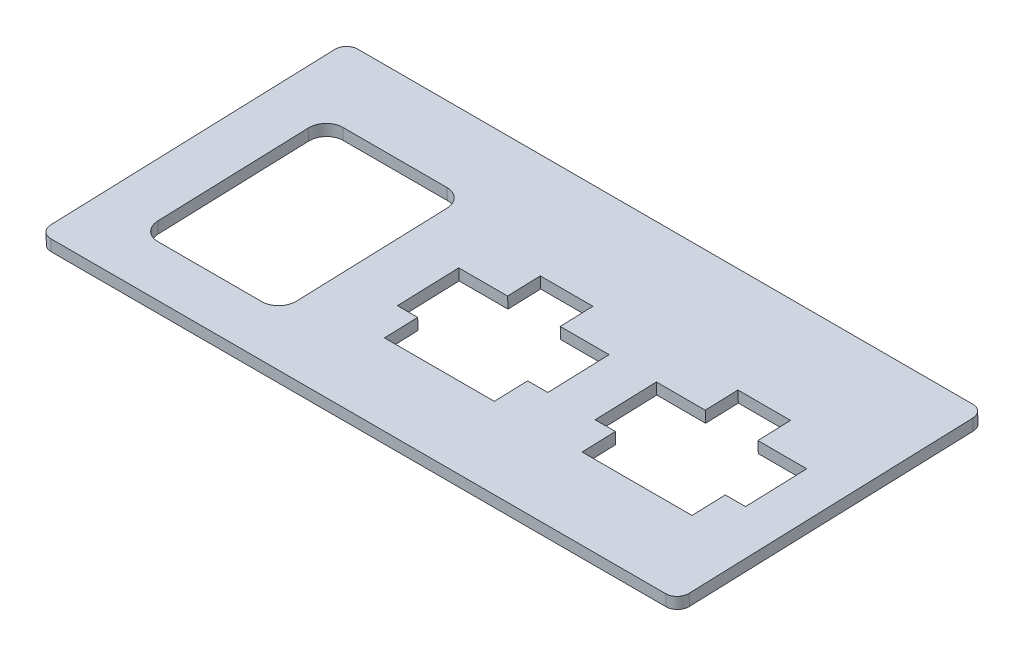
from build123d import *

# Parameters (mm, degrees)
SKETCH1_W           = 110.35
SKETCH1_H           = 53.101321069
BOSS_EXTRUDE1_DEPTH = 2
CUT_EXTRUDE1_REACH  = 75.729
FILLET1_R           = 2


with BuildPart() as part:
    # Sketch1 → Boss-Extrude1 (new body)
    with BuildSketch(Plane(origin=(0, -68.990841945, -2.409213289), x_dir=(1, 0, 0), z_dir=(0, 0.9993908270190958, 0.03489949670250105))):
        with Locations((0, 22.243763745)):
            Rectangle(SKETCH1_W, SKETCH1_H)
    extrude(amount=BOSS_EXTRUDE1_DEPTH)

    # Sketch2 → Cut-Extrude1 (cut, up to next)
    with BuildSketch(Plane(origin=(0, -68.990841945, -2.409213289), x_dir=(1, 0, 0), z_dir=(0, -0.9993908270190958, -0.03489949670250106)), mode=Mode.PRIVATE) as cut_extrude1_sk1:
        Polygon((-4.05, -25.568778974), (-4.05, -31.218778974), (5.05, -31.218778974), (5.05, -25.568778974), (13.5, -25.568778974), (13.5, -14.968778974), (10, -14.968778974), (10, -9.218778974), (-9, -9.218778974), (-9, -14.968778974), (-12.5, -14.968778974), (-12.5, -25.568778974), align=None)
    cut_extrude1_tool1 = extrude(cut_extrude1_sk1.sketch, amount=-CUT_EXTRUDE1_REACH, mode=Mode.PRIVATE) & part.part
    # Sketch2 → Cut-Extrude1 (cut, up to next)
    with BuildSketch(Plane(origin=(0, -68.990841945, -2.409213289), x_dir=(1, 0, 0), z_dir=(0, -0.9993908270190958, -0.03489949670250106)), mode=Mode.PRIVATE) as cut_extrude1_sk2:
        with BuildLine():
            Line((-43.175, -4.218778974), (-25.175, -4.218778974))
            ThreePointArc((-25.175, -4.218778974), (-23.053679656, -5.09745863), (-22.175, -7.218778974))
            Line((-22.175, -7.218778974), (-22.175, -33.218778974))
            ThreePointArc((-22.175, -33.218778974), (-23.053679656, -35.340099317), (-25.175, -36.218778974))
            Line((-25.175, -36.218778974), (-43.175, -36.218778974))
            ThreePointArc((-43.175, -36.218778974), (-45.296320344, -35.340099317), (-46.175, -33.218778974))
            Line((-46.175, -33.218778974), (-46.175, -7.218778974))
            ThreePointArc((-46.175, -7.218778974), (-45.296320344, -5.09745863), (-43.175, -4.218778974))
        make_face()
    cut_extrude1_tool2 = extrude(cut_extrude1_sk2.sketch, amount=-CUT_EXTRUDE1_REACH, mode=Mode.PRIVATE) & part.part
    # Sketch2 → Cut-Extrude1 (cut, up to next)
    with BuildSketch(Plane(origin=(0, -68.990841945, -2.409213289), x_dir=(1, 0, 0), z_dir=(0, -0.9993908270190958, -0.03489949670250106)), mode=Mode.PRIVATE) as cut_extrude1_sk3:
        Polygon((30.125, -25.568778974), (21.675, -25.568778974), (21.675, -14.968778974), (25.175, -14.968778974), (25.175, -9.218778974), (44.175, -9.218778974), (44.175, -14.968778974), (47.675, -14.968778974), (47.675, -25.568778974), (39.225, -25.568778974), (39.225, -31.218778974), (30.125, -31.218778974), align=None)
    cut_extrude1_tool3 = extrude(cut_extrude1_sk3.sketch, amount=-CUT_EXTRUDE1_REACH, mode=Mode.PRIVATE) & part.part
    add(cut_extrude1_tool1.solids().sort_by_distance((0.5, -68.3215, -21.576669))[0], mode=Mode.SUBTRACT)
    add(cut_extrude1_tool2.solids().sort_by_distance((-34.175, -68.285217, -22.615676))[0], mode=Mode.SUBTRACT)
    add(cut_extrude1_tool3.solids().sort_by_distance((34.675, -68.3215, -21.576669))[0], mode=Mode.SUBTRACT)

    # Fillet1
    fillet1_edges = [part.edges().sort_by_distance(p)[0] for p in [
        (-55.175, -68.141759648, 1.929959353),
        (55.175, -68.141759648, 1.929959353),
        (55.175, -66.288550269, -51.139013826),
        (-55.175, -66.288550269, -51.139013826),
    ]]
    fillet(fillet1_edges, radius=FILLET1_R)


solid = part.part
